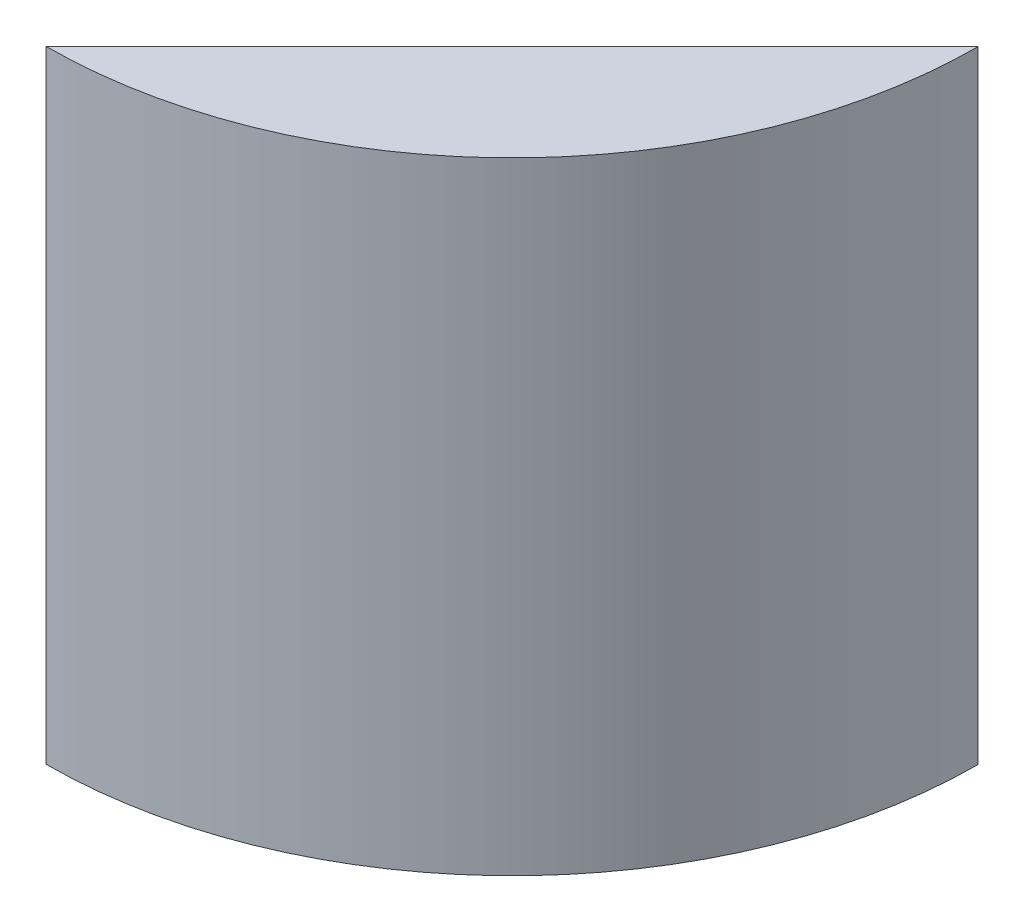
from build123d import *

# Parameters (mm, degrees)
SKETCH1_R           = 85.725
BOSS_EXTRUDE1_DEPTH = 114.3
CUT_EXTRUDE1_DEPTH  = 152.4
SKETCH4_R           = 2.778125
CUT_EXTRUDE2_DEPTH  = 12.7
SKETCH5_R           = 6.985
CUT_EXTRUDE3_DEPTH  = 6.35


with BuildPart() as part:
    # Sketch1 → Boss-Extrude1 (new body)
    with BuildSketch(Plane(origin=(0, 0, 0), x_dir=(1, 0, 0), z_dir=(0, 1, 0))):
        Circle(SKETCH1_R)
    extrude(amount=BOSS_EXTRUDE1_DEPTH)

    # Sketch2 → Cut-Extrude1 (cut)
    with BuildSketch(Plane(origin=(0, 114.3, 0), x_dir=(1, 0, 0), z_dir=(0, 1, 0))):
        Polygon((85.724933621, -0.10668), (0, -85.725), (-45.627504124, -96.719379999), (-137.428949547, 46.173941299), (19.12530113, 101.910533163), (109.833872203, 30.600481808), align=None)
    extrude(amount=-CUT_EXTRUDE1_DEPTH, mode=Mode.SUBTRACT)

    # Sketch4 → Cut-Extrude2 (cut)
    with BuildSketch(Plane(origin=(42.862466811, 0, 42.91584), x_dir=(-0.7075466219424854, 0, 0.7066666666666667), z_dir=(-0.7066666666666667, 0, -0.7075466219424854))):
        with Locations((40.618496709, 93.472)):
            Circle(SKETCH4_R)
        with Locations((-4.847503262, 93.472)):
            Circle(SKETCH4_R)
        with Locations((-4.847503262, 25.4)):
            Circle(SKETCH4_R)
        with Locations((40.618496632, 25.4)):
            Circle(SKETCH4_R)
    extrude(amount=-CUT_EXTRUDE2_DEPTH, mode=Mode.SUBTRACT)

    # Sketch5 → Cut-Extrude3 (cut)
    with BuildSketch(Plane(origin=(0, 0, 0), x_dir=(-1, 0, 0), z_dir=(0, -1, 0))):
        with Locations((-51.837133477, -51.901682099)):
            Circle(SKETCH5_R)
    extrude(amount=-CUT_EXTRUDE3_DEPTH, mode=Mode.SUBTRACT)


solid = part.part
